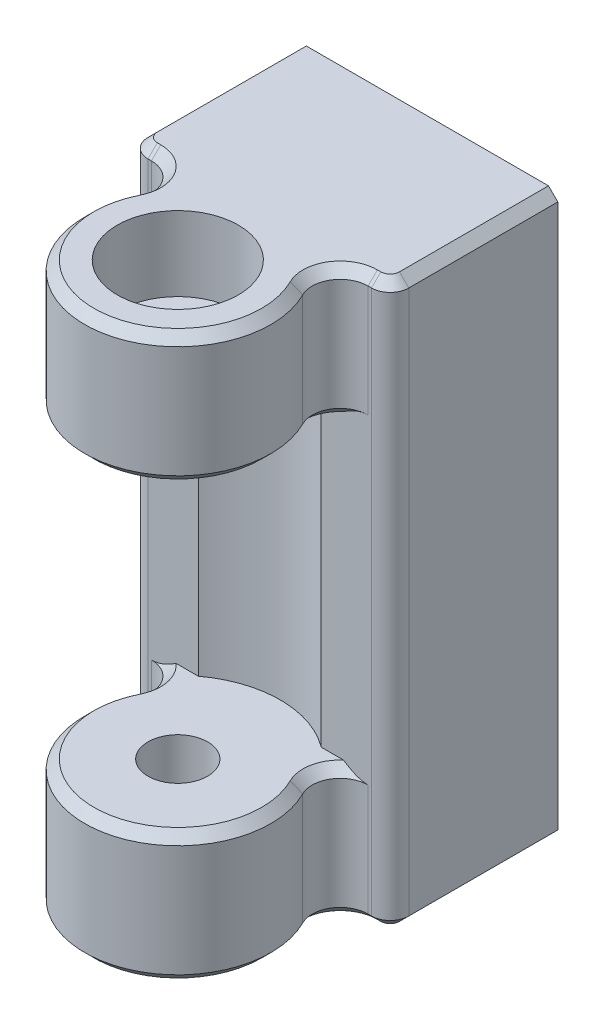
from build123d import *

# Parameters (mm, degrees)
CROQUIS2_R                 = 1.6
SALIENTE_EXTRUIR1_DEPTH    = 15.1
CORTAR_EXTRUIR4_DEPTH      = 8.1
CORTAR_EXTRUIR2_DEPTH      = 37.049965326
CORTAR_EXTRUIR2_DEPTH_BACK = 4
CROQUIS4_R                 = 3.25
CORTAR_EXTRUIR3_DEPTH      = 4
REDONDEO2_R                = 1
CHAFL_N1_SIZE              = 0.5


with BuildPart() as part:
    # Croquis2 → Saliente-Extruir1 (new, symmetric)
    with BuildSketch(Plane(origin=(0, 0, 0), x_dir=(0, 0, -1), z_dir=(0, 1, 0))):
        with BuildLine():
            Line((0, -7), (0, 7))
            Line((0, 7), (-9, 7))
            Line((-9, 7), (-9, 5.817215829))
            ThreePointArc((-9, 5.817215829), (-9.710647783, 4.541706881), (-11.169230769, 4.474781407))
            ThreePointArc((-11.169230769, 4.474781407), (-18.4, 0), (-11.169230769, -4.474781407))
            ThreePointArc((-11.169230769, -4.474781407), (-9.710647783, -4.541706881), (-9, -5.817215829))
            Line((-9, -5.817215829), (-9, -7))
            Line((-9, -7), (0, -7))
        make_face()
        with Locations(Location((-13.4, 0, 0), (0, 0, 180))):
            Circle(CROQUIS2_R, mode=Mode.SUBTRACT)
    extrude(amount=SALIENTE_EXTRUIR1_DEPTH, both=True)

    # Croquis6 → Cortar-Extruir4 (cut, symmetric)
    with BuildSketch(Plane(origin=(0, 0, 0), x_dir=(1, 0, 0), z_dir=(0, 1, 0))):
        with BuildLine():
            Line((-7, -9), (-3.3, -9))
            ThreePointArc((-3.3, -9), (0, -7.9), (3.3, -9))
            Line((3.3, -9), (7, -9))
            Line((7, -9), (7, -18.9))
            Line((7, -18.9), (-7, -18.9))
            Line((-7, -18.9), (-7, -9))
        make_face()
    extrude(amount=CORTAR_EXTRUIR4_DEPTH, both=True, mode=Mode.SUBTRACT)

    # Croquis4 → Cortar-Extruir2 (cut, two sides: drawn at the far end of the back side and taken through both)
    with BuildSketch(Plane(origin=(0, 15.1, 0), x_dir=(1, 0, 0), z_dir=(0, 1, 0)).offset(-CORTAR_EXTRUIR2_DEPTH_BACK)):
        with Locations(Location((0, -13.4, 0), (0, 0, 90))):
            Circle(CROQUIS4_R)
    extrude(amount=CORTAR_EXTRUIR2_DEPTH + CORTAR_EXTRUIR2_DEPTH_BACK, mode=Mode.SUBTRACT)

    # Croquis5 → Cortar-Extruir3 (cut)
    with BuildSketch(Plane.XZ.offset(15.1)):
        Polygon((1.5011107, 10.8), (3.0022214, 13.4), (1.5011107, 16), (-1.5011107, 16), (-3.0022214, 13.4), (-1.5011107, 10.8), align=None)
    extrude(amount=-CORTAR_EXTRUIR3_DEPTH, mode=Mode.SUBTRACT)

    # Redondeo2
    redondeo2_edges = [part.edges().sort_by_distance(p)[0] for p in [
        (7, 0, 9),
        (-7, 0, 9),
    ]]
    fillet(redondeo2_edges, radius=REDONDEO2_R)

    # Chaflán1
    # the kernel refuses this chamfer: 0.5 mm, written as the material it takes off along each edge
    with BuildSketch(Plane(origin=(0, -15.1, 13.4), x_dir=(-0.8949562813691682, 0, -0.44615384615384657), z_dir=(0.44615384615384657, 0, -0.8949562813691682))) as chafl_n1_piece_1:
        Polygon((5 - CHAFL_N1_SIZE, 0), (5, CHAFL_N1_SIZE), (5, 0), align=None)
    revolve(axis=Axis((0, -15.1, 13.4), (0, 1, 0)), revolution_arc=232.994370335, mode=Mode.SUBTRACT)
    with BuildSketch(Plane(origin=(-5.817215829, -15.1, 10.5), x_dir=(0, 0, -1), z_dir=(-1, 0, 0))) as chafl_n1_piece_2:
        Polygon((1.5 + CHAFL_N1_SIZE, 0), (1.5, -CHAFL_N1_SIZE), (1.5, 0), align=None)
    revolve(axis=Axis((-5.817215829, -15.1, 10.5), (0, -1, 0)), revolution_arc=116.497185168, mode=Mode.SUBTRACT)
    with BuildSketch(Plane(origin=(-7, -15.1, -1.285841494), x_dir=(0.9996219169112968, -0.027495876610585647, 0), z_dir=(0, 0, 1)), Plane(origin=(-7, 15.1, -1.285841494), x_dir=(-0.027495876610585647, -0.9996219169112968, 0), z_dir=(0, 0, 1)), Plane(origin=(7, -15.1, 8), x_dir=(-0.9996219169112968, -0.027495876610585647, 0), z_dir=(0, 0, -1)), Plane(origin=(7, 15.1, 8), x_dir=(0.027495876610585647, -0.9996219169112968, 0), z_dir=(0, 0, -1))) as chafl_n1_piece_3:
        Polygon((CHAFL_N1_SIZE * 0.999621916911, CHAFL_N1_SIZE * 0.0274958766106), (-CHAFL_N1_SIZE * 0.0274958766106, CHAFL_N1_SIZE * 0.999621916911), (0, 0), align=None)
    extrude(amount=9.285841494, mode=Mode.SUBTRACT)
    with BuildSketch(Plane(origin=(-5.817215829, 15.1, 10.5), x_dir=(0, 0, -1), z_dir=(-1, 0, 0))) as chafl_n1_piece_4:
        Polygon((1.5 + CHAFL_N1_SIZE, 0), (1.5, CHAFL_N1_SIZE), (1.5, 0), align=None)
    revolve(axis=Axis((-5.817215829, 15.1, 10.5), (0, -1, 0)), revolution_arc=116.497185168, mode=Mode.SUBTRACT)
    with BuildSketch(Plane(origin=(0, 15.1, 13.4), x_dir=(-0.8949562813691682, 0, -0.44615384615384657), z_dir=(0.44615384615384657, 0, -0.8949562813691682))) as chafl_n1_piece_5:
        Polygon((5 - CHAFL_N1_SIZE, 0), (5, -CHAFL_N1_SIZE), (5, 0), align=None)
    revolve(axis=Axis((0, 15.1, 13.4), (0, 1, 0)), revolution_arc=232.994370335, mode=Mode.SUBTRACT)
    with BuildSketch(Plane(origin=(5.817215829, 15.1, 10.5), x_dir=(-0.8949562813691686, 0, 0.44615384615384585), z_dir=(0.44615384615384585, 0, 0.8949562813691686))) as chafl_n1_piece_6:
        Polygon((1.5 + CHAFL_N1_SIZE, 0), (1.5, CHAFL_N1_SIZE), (1.5, 0), align=None)
    revolve(axis=Axis((5.817215829, 15.1, 10.5), (0, -1, 0)), revolution_arc=116.497185168, mode=Mode.SUBTRACT)
    with BuildSketch(Plane(origin=(5.817215829, 15.1, 9), x_dir=(0, -0.9996219169112968, 0.027495876610585647), z_dir=(1, 0, 0)), Plane(origin=(-6, -15.1, 9), x_dir=(0, -0.027495876610585647, -0.9996219169112968), z_dir=(1, 0, 0)), Plane(origin=(-6, 15.1, 9), x_dir=(0, -0.9996219169112968, 0.027495876610585647), z_dir=(1, 0, 0)), Plane(origin=(5.817215829, -15.1, 9), x_dir=(0, -0.027495876610585647, -0.9996219169112968), z_dir=(1, 0, 0))) as chafl_n1_piece_7:
        Polygon((CHAFL_N1_SIZE * 0.999621916911, CHAFL_N1_SIZE * 0.0274958766106), (-CHAFL_N1_SIZE * 0.0274958766106, CHAFL_N1_SIZE * 0.999621916911), (0, 0), align=None)
    extrude(amount=0.182784171, mode=Mode.SUBTRACT)
    with BuildSketch(Plane(origin=(-5.817215829, 8.1, 10.5), x_dir=(0.8949562813691686, 0, 0.44615384615384585), z_dir=(-0.44615384615384585, 0, 0.8949562813691686))) as chafl_n1_piece_8_section:
        Polygon((1.5 + CHAFL_N1_SIZE, 0), (1.5, CHAFL_N1_SIZE), (1.5, 0), align=None)
    chafl_n1_piece_8 = revolve(axis=Axis((-5.817215829, 8.1, 10.5), (0, 1, 0)), revolution_arc=165.645776503, mode=Mode.PRIVATE)
    chafl_n1_piece_8 = split(chafl_n1_piece_8, bisect_by=Plane(origin=(-4.168851262, 8.241008039, 9), z_dir=(0, 0, 1)), keep=Keep.TOP, mode=Mode.PRIVATE)
    add(chafl_n1_piece_8, mode=Mode.SUBTRACT)
    with BuildSketch(Plane(origin=(0, 8.1, 13.4), x_dir=(-0.8949562813691682, 0, -0.44615384615384657), z_dir=(0.44615384615384657, 0, -0.8949562813691682))) as chafl_n1_piece_9:
        Polygon((5 - CHAFL_N1_SIZE, 0), (5, CHAFL_N1_SIZE), (5, 0), align=None)
    revolve(axis=Axis((0, 8.1, 13.4), (0, 1, 0)), revolution_arc=232.994370335, mode=Mode.SUBTRACT)
    with BuildSketch(Plane(origin=(5.817215829, 8.1, 10.5), x_dir=(0.7564084690774899, 0, -0.6540995550433039), z_dir=(0.6540995550433039, 0, 0.7564084690774899))) as chafl_n1_piece_10_section:
        Polygon((1.5, CHAFL_N1_SIZE), (1.5 + CHAFL_N1_SIZE, 0), (1.5, 0), align=None)
    chafl_n1_piece_10 = revolve(axis=Axis((5.817215829, 8.1, 10.5), (0, 1, 0)), revolution_arc=165.645776503, mode=Mode.PRIVATE)
    chafl_n1_piece_10 = split(chafl_n1_piece_10, bisect_by=Plane(origin=(4.495767194, 8.276282953, 9), z_dir=(0, 0, 1)), keep=Keep.TOP, mode=Mode.PRIVATE)
    add(chafl_n1_piece_10, mode=Mode.SUBTRACT)
    with BuildSketch(Plane(origin=(-5.817215829, -8.1, 10.5), x_dir=(0.8949562813691686, 0, 0.44615384615384585), z_dir=(-0.44615384615384585, 0, 0.8949562813691686))) as chafl_n1_piece_11_section:
        Polygon((1.5, -CHAFL_N1_SIZE), (1.5 + CHAFL_N1_SIZE, 0), (1.5, 0), align=None)
    chafl_n1_piece_11 = revolve(axis=Axis((-5.817215829, -8.1, 10.5), (0, 1, 0)), revolution_arc=165.645776503, mode=Mode.PRIVATE)
    chafl_n1_piece_11 = split(chafl_n1_piece_11, bisect_by=Plane(origin=(-4.495767364, -8.276282993, 9), z_dir=(0, 0, 1)), keep=Keep.TOP, mode=Mode.PRIVATE)
    add(chafl_n1_piece_11, mode=Mode.SUBTRACT)
    with BuildSketch(Plane(origin=(0, -8.1, 13.4), x_dir=(-0.8949562813691682, 0, -0.44615384615384657), z_dir=(0.44615384615384657, 0, -0.8949562813691682))) as chafl_n1_piece_12:
        Polygon((5, -CHAFL_N1_SIZE), (5 - CHAFL_N1_SIZE, 0), (5, 0), align=None)
    revolve(axis=Axis((0, -8.1, 13.4), (0, 1, 0)), revolution_arc=232.994370335, mode=Mode.SUBTRACT)
    with BuildSketch(Plane(origin=(5.817215829, -8.1, 10.5), x_dir=(0.7564084690774899, 0, -0.6540995550433039), z_dir=(0.6540995550433039, 0, 0.7564084690774899))) as chafl_n1_piece_13_section:
        Polygon((1.5, -CHAFL_N1_SIZE), (1.5 + CHAFL_N1_SIZE, 0), (1.5, 0), align=None)
    chafl_n1_piece_13 = revolve(axis=Axis((5.817215829, -8.1, 10.5), (0, 1, 0)), revolution_arc=165.645776503, mode=Mode.PRIVATE)
    chafl_n1_piece_13 = split(chafl_n1_piece_13, bisect_by=Plane(origin=(4.495767194, -8.276282953, 9), z_dir=(0, 0, 1)), keep=Keep.TOP, mode=Mode.PRIVATE)
    add(chafl_n1_piece_13, mode=Mode.SUBTRACT)
    with BuildSketch(Plane(origin=(6, -15.1, 8), x_dir=(1, 0, 0), z_dir=(0, 0, -1))) as chafl_n1_piece_14:
        Polygon((1 - CHAFL_N1_SIZE, 0), (1, -CHAFL_N1_SIZE), (1, 0), align=None)
    revolve(axis=Axis((6, -15.1, 8), (0, -1, 0)), revolution_arc=90, mode=Mode.SUBTRACT)
    with BuildSketch(Plane(origin=(-6, -15.1, 8), x_dir=(-1, 0, 0), z_dir=(0, 0, -1))) as chafl_n1_piece_15:
        Polygon((1 - CHAFL_N1_SIZE, 0), (1, CHAFL_N1_SIZE), (1, 0), align=None)
    revolve(axis=Axis((-6, -15.1, 8), (0, 1, 0)), revolution_arc=90, mode=Mode.SUBTRACT)
    with BuildSketch(Plane(origin=(6, 15.1, 8), x_dir=(1, 0, 0), z_dir=(0, 0, -1))) as chafl_n1_piece_16:
        Polygon((1, CHAFL_N1_SIZE), (1 - CHAFL_N1_SIZE, 0), (1, 0), align=None)
    revolve(axis=Axis((6, 15.1, 8), (0, -1, 0)), revolution_arc=90, mode=Mode.SUBTRACT)
    with BuildSketch(Plane(origin=(5.817215829, -15.1, 10.5), x_dir=(-0.8949562813691686, 0, 0.44615384615384585), z_dir=(0.44615384615384585, 0, 0.8949562813691686))) as chafl_n1_piece_17:
        Polygon((1.5 + CHAFL_N1_SIZE, 0), (1.5, -CHAFL_N1_SIZE), (1.5, 0), align=None)
    revolve(axis=Axis((5.817215829, -15.1, 10.5), (0, -1, 0)), revolution_arc=116.497185168, mode=Mode.SUBTRACT)
    with BuildSketch(Plane(origin=(-6, 15.1, 8), x_dir=(-1, 0, 0), z_dir=(0, 0, -1))) as chafl_n1_piece_18:
        Polygon((1, -CHAFL_N1_SIZE), (1 - CHAFL_N1_SIZE, 0), (1, 0), align=None)
    revolve(axis=Axis((-6, 15.1, 8), (0, 1, 0)), revolution_arc=90, mode=Mode.SUBTRACT)


solid = part.part
